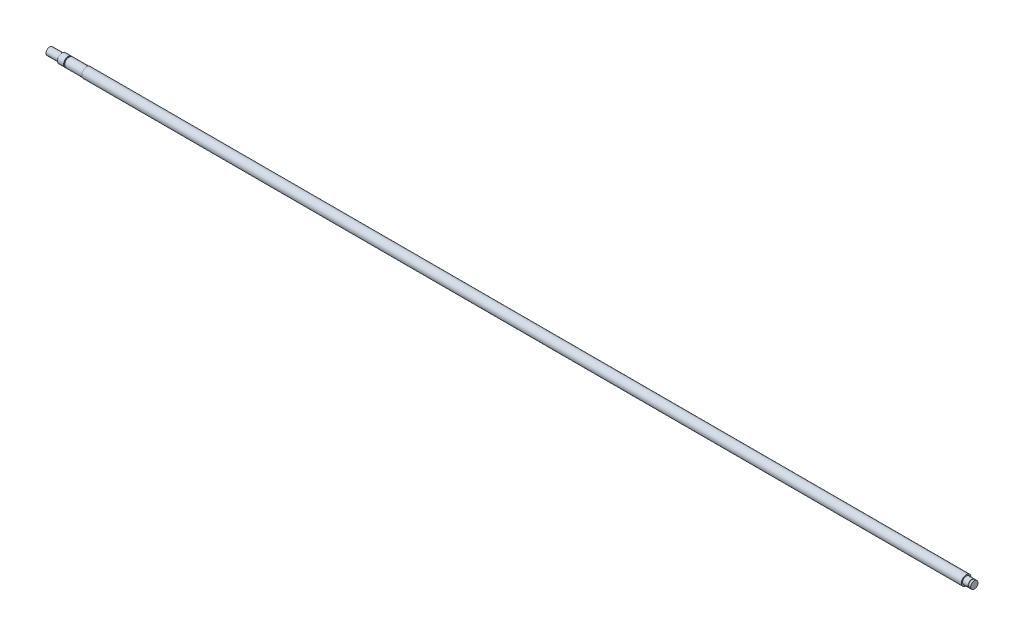
from build123d import *


with BuildPart() as part:
    # Sketch1 → Revolve1 (revolve)
    with BuildSketch(Plane.XY):
        Polygon((-60, 0), (1440, 0), (1440, 6), (1437.15, 6), (1437.15, 5.65), (1436, 5.65), (1436, 6), (1427, 6), (1427, 8), (0, 8), (0, 7.5), (-28, 7.5), (-28, 6), (-30, 6), (-30, 7.5), (-40, 7.5), (-40, 6), (-60, 6), align=None)
    revolve(axis=Axis((-60, 0, 0), (1, 0, 0)))


solid = part.part
